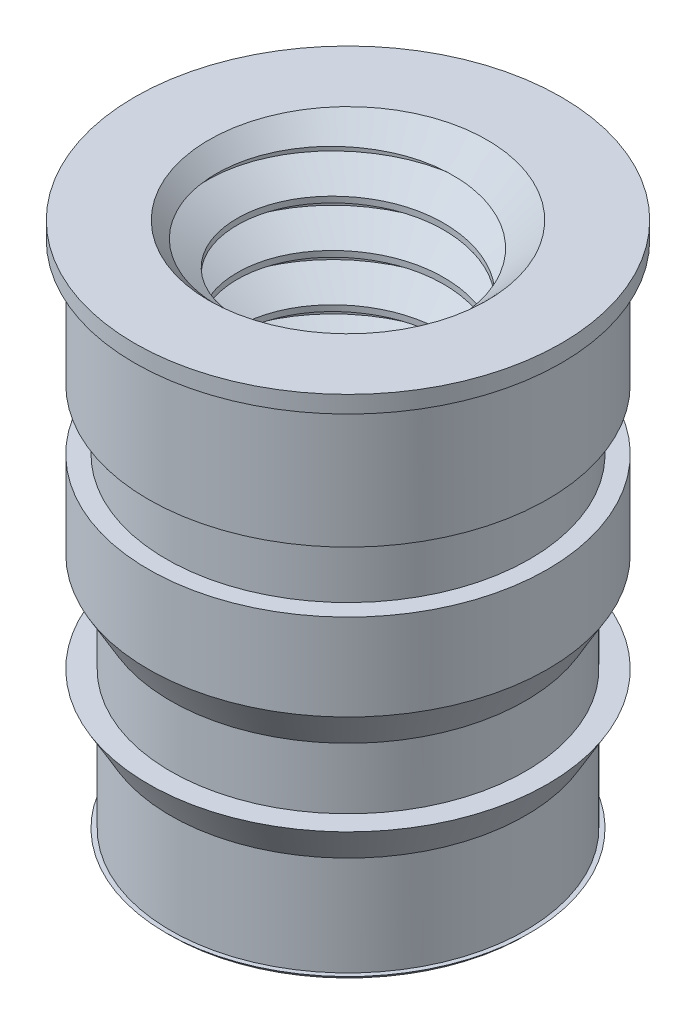
from build123d import *

# Parameters (mm, degrees)
SKETCH1_R              = 2.6399999999999992
EXTRUDE1_DEPTH         = 7.9
SKETCH1_4_R            = 2.9700000000000006
EXTRUDE2_DEPTH         = 4.303507
SKETCH1_3_R            = 3.175
EXTRUDE3_DEPTH         = 0.254
SKETCH2_R              = 2.9700000000000006
EXTRUDE4_DEPTH         = 0.571577
EXTRUDE4_TAPER         = 30.000000000000068
SKETCH8_R              = 1.5453366630131697
EXTRUDE6_DEPTH         = 7.9
CHAMFER1_SIZE          = 0.5249999999999999
CUT_SWEEP1_PITCH       = 0.699999999999995
CUT_SWEEP1_HEIGHT      = 8.914159265358949
CUT_SWEEP1_RADIUS      = 2
CUT_SWEEP1_START_ANGLE = -90.00000000000055
SKETCH11_W             = 0.46999999999999975
SKETCH11_H             = 0.9017000000000008


# Read off the part's stored shape, not the designer's step: Extrude5
with BuildPart() as part:
    # Sketch1 → Extrude1 (new body)
    with BuildSketch(Plane(origin=(0, 0, 0), x_dir=(1, 0, 0), z_dir=(0, 1, 0))):
        with Locations(Location((0, 0, 0), (0, 0, 270))):
            Circle(SKETCH1_R)
    extrude(amount=-EXTRUDE1_DEPTH)

    # Sketch1<4> → Extrude2 (add)
    with BuildSketch(Plane(origin=(0, 0, 0), x_dir=(1, 0, 0), z_dir=(0, 1, 0))):
        with Locations(Location((0, 0, 0), (0, 0, 270))):
            Circle(SKETCH1_4_R)
    extrude(amount=-EXTRUDE2_DEPTH)

    # Sketch1<3> → Extrude3 (add)
    with BuildSketch(Plane(origin=(0, 0, 0), x_dir=(1, 0, 0), z_dir=(0, 1, 0))):
        with Locations(Location((0, 0, 0), (0, 0, 270))):
            Circle(SKETCH1_3_R)
    extrude(amount=-EXTRUDE3_DEPTH)

    # Sketch2 → Extrude4 (add)
    with BuildSketch(Plane.XZ.offset(4.303506535994249)):
        with Locations(Location((0, 0, 0), (0, 0, 90))):
            Circle(SKETCH2_R)
    extrude(amount=EXTRUDE4_DEPTH, taper=EXTRUDE4_TAPER)

    # Extrude5 outline → Extrude5 (revolve)
    with BuildSketch(Plane.XY):
        Polygon((2.64, -7.835), (2.64, -7.9), (2.705, -7.835), align=None)
    revolve(axis=Axis((0, 0, 0), (0, 1, 0)))

    # Sketch5 → Revolve1 (revolve)
    with BuildSketch(Plane.XY):
        Polygon((-2.6399999999999992, -6.355041651245989), (-2.9700000000000006, -5.78346488474826), (-2.6399999999999992, -5.78346488474826), align=None)
    revolve(axis=Axis((0, 0, 0), (1.2e-16, -1, 0)))

    # Sketch8 → Extrude6 (cut)
    with BuildSketch(Plane(origin=(0, 0, 0), x_dir=(1, 0, 0), z_dir=(0, 1, 0))):
        with Locations(Location((0, 0, 0), (0, 0, 270))):
            Circle(SKETCH8_R)
    extrude(amount=-EXTRUDE6_DEPTH, mode=Mode.SUBTRACT)

    # Chamfer1
    chamfer1_edges = [part.edges().sort_by_distance(p)[0] for p in [
        (1.16e-15, -7.9, -1.5453366630131697),
        (1.16e-15, 0, -1.5453366630131697),
    ]]
    chamfer(chamfer1_edges, length=CHAMFER1_SIZE)

    # Cut-Sweep1: sweep along a helix
    with BuildLine() as cut_sweep1_path:
        add(Helix(CUT_SWEEP1_PITCH, CUT_SWEEP1_HEIGHT, CUT_SWEEP1_RADIUS, center=(0, 0, 0), direction=(0, -1, 0), mode=Mode.PRIVATE).rotate(Axis((0, 0, 0), (0, -1, 0)), CUT_SWEEP1_START_ANGLE))
    # Sketch7 → Cut-Sweep1 (sweep, cut)
    with BuildSketch(Plane.XY):
        Polygon((-2, 0.35000000000000014), (-2, 0.26250000000000007), (-1.5074480515976005, -0.02187499999999989), (-1.5074480515976005, 0.6343749999999995), align=None)
    sweep(path=cut_sweep1_path.line, is_frenet=True, mode=Mode.SUBTRACT)

    # Sketch11 → Cut-Revolve1 (revolve, cut)
    with BuildSketch(Plane.XY):
        with Locations((-2.9399999999999995, -2.5645416512459884)):
            Rectangle(SKETCH11_W, SKETCH11_H)
    revolve(axis=Axis((0, 0, 0), (1.2e-16, -1, 0)), mode=Mode.SUBTRACT)


solid = part.part
